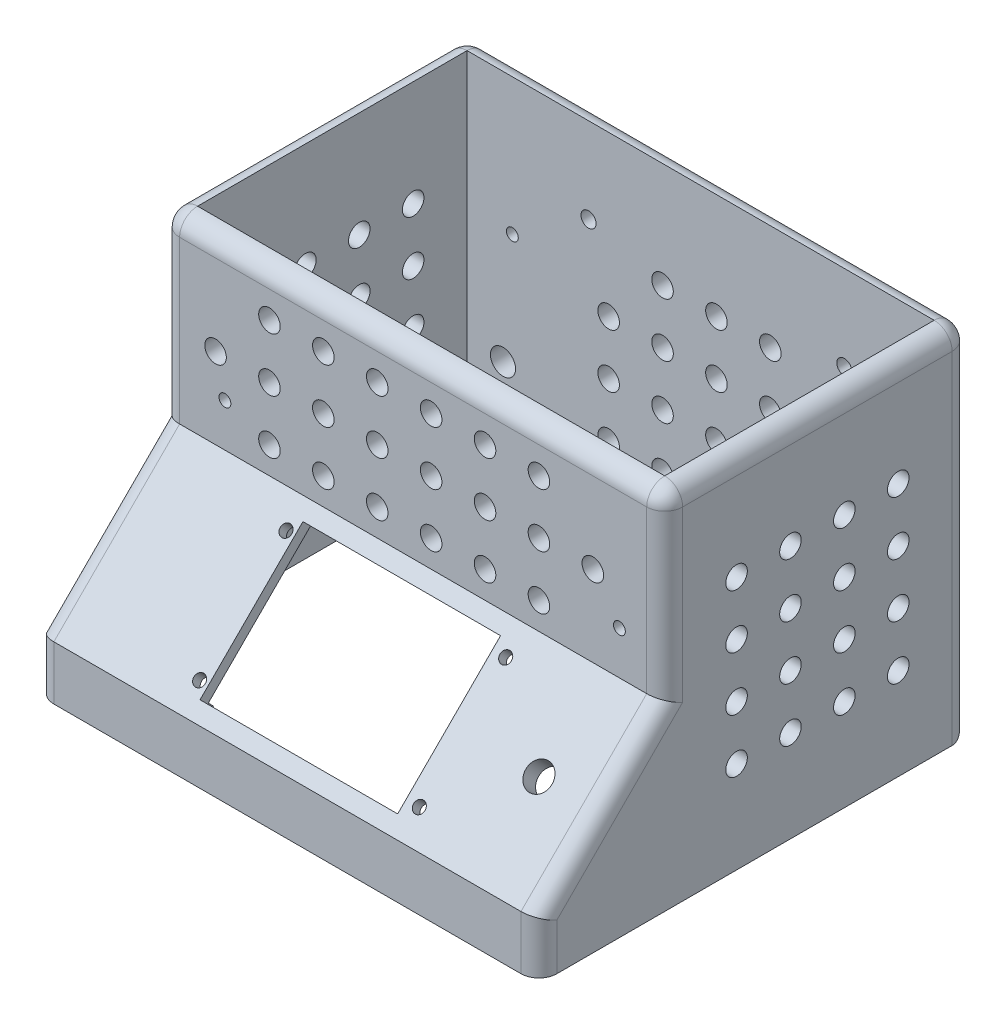
from build123d import *

# Parameters (mm, degrees)
SKETCH2_W                       = 85
SKETCH2_H                       = 100
BOSS_EXTRUDE1_DEPTH             = 70
SHELL1_T                        = -5
CUT_EXTRUDE1_REACH              = 146.59
SKETCH3_W                       = 130
SKETCH3_H                       = 110
SKETCH4_W                       = 55
SKETCH4_H                       = 40.5
CUT_EXTRUDE2_DEPTH              = 5
SKETCH5_W                       = 10.3
SKETCH5_H                       = 10.3
SKETCH5_R                       = 1.65
BOSS_EXTRUDE2_DEPTH             = 7
BOSS_EXTRUDE2_2_DEPTH           = 7
BOSS_EXTRUDE2_3_DEPTH           = 7
BOSS_EXTRUDE2_4_DEPTH           = 7
SKETCH6_R                       = 3.65
CUT_EXTRUDE3_DEPTH              = 10
SKETCH7_W                       = 10.3
SKETCH7_H                       = 10.3
SKETCH7_R                       = 1.65
BOSS_EXTRUDE3_DEPTH             = 5
CUT_EXTRUDE4_DEPTH              = 3
SKETCH14_R                      = 3.5
CUT_EXTRUDE19_DEPTH             = 5
SKETCH23_R                      = 2.1
CUT_EXTRUDE21_DEPTH             = 5
SKETCH22_R                      = 1.65
CUT_EXTRUDE27_DEPTH             = 2
SKETCH20_W                      = 6.75
SKETCH20_H                      = 40.25
SKETCH20_R                      = 1.6
SKETCH20_W_2                    = 5.5
CUT_EXTRUDE20_DEPTH             = 2
FILLET1_R                       = 5
CUT_EXTRUDE22_REACH             = 169.649
SKETCH28_R                      = 3
SKETCH29_R                      = 3
CUT_EXTRUDE23_DEPTH             = 5
SKETCH30_R                      = 1.6
CUT_EXTRUDE24_DEPTH             = 5
SKETCH31_R                      = 3
CUT_EXTRUDE26_DEPTH             = 5
CUT_EXTRUDE28_START             = -10
SKETCH32_W                      = 10.3
SKETCH32_H                      = 10.3
SKETCH32_W_2                    = 2.5
SKETCH32_H_2                    = 2.5
SKETCH32_W_3                    = 130
SKETCH32_H_3                    = 75
CUT_EXTRUDE28_DEPTH             = 10
CUT_EXTRUDE30_REACH             = 145.614
SKETCH34_R                      = 1.65
CUT_EXTRUDE30_DIRECTION_2_REACH = 145.614


with BuildPart() as part:
    # Sketch2 → Boss-Extrude1 (new, symmetric)
    with BuildSketch(Plane(origin=(0, 0, 0), x_dir=(0, 0, -1), z_dir=(1, 0, 0))):
        Rectangle(SKETCH2_W, SKETCH2_H)
        Polygon((-77.5, -35), (-77.5, -50), (-42.5, -50), (-42.5, 0), align=None)
    extrude(amount=BOSS_EXTRUDE1_DEPTH, both=True)

    # Shell1
    shell1_openings = [part.faces().sort_by_distance(p)[0] for p in [
        (0, 50, 0),
    ]]
    offset(amount=SHELL1_T, openings=shell1_openings, kind=Kind.INTERSECTION)

    # Sketch3 → Cut-Extrude1 (cut, up to next)
    with BuildSketch(Plane.XZ.offset(50), mode=Mode.PRIVATE) as cut_extrude1_sk1:
        with Locations((0, 17.5)):
            Rectangle(SKETCH3_W, SKETCH3_H)
    cut_extrude1_tool1 = extrude(cut_extrude1_sk1.sketch, amount=-CUT_EXTRUDE1_REACH, mode=Mode.PRIVATE) & part.part
    add(cut_extrude1_tool1.solids().sort_by_distance((0, -50, 17.5))[0], mode=Mode.SUBTRACT)

    # Sketch4 → Cut-Extrude2 (cut)
    with BuildSketch(Plane(origin=(0, 21.25, 21.25), x_dir=(1, 0, 0), z_dir=(0, 0.7071067811865464, 0.7071067811865488))):
        with Locations((0, -54.800775542)):
            Rectangle(SKETCH4_W, SKETCH4_H)
    extrude(amount=-CUT_EXTRUDE2_DEPTH, mode=Mode.SUBTRACT)

    # Sketch6 → Cut-Extrude3 (cut)
    with BuildSketch(Plane(origin=(0, 21.25, 21.25), x_dir=(1, 0, 0), z_dir=(0, 0.7071067811865464, 0.7071067811865488))):
        with Locations(Location((52.5, -54.800775542, 0), (0, 0, 270))):
            Circle(SKETCH6_R)
    extrude(amount=-CUT_EXTRUDE3_DEPTH, mode=Mode.SUBTRACT)

    # Sketch7 → Boss-Extrude3 (add)
    # profile 1 of 4: a face of its own
    with BuildSketch(Plane.XZ.offset(50)):
        with Locations((59.85, -32.35)):
            Rectangle(SKETCH7_W, SKETCH7_H)
        with Locations(Location((59.85, -32.35, 0), (0, 0, 270))):
            Circle(SKETCH7_R, mode=Mode.SUBTRACT)
    # profile 2 of 4: a face of its own
    with BuildSketch(Plane.XZ.offset(50)):
        with Locations((-59.85, -32.35)):
            Rectangle(SKETCH7_W, SKETCH7_H)
        with Locations(Location((-59.85, -32.35, 0), (0, 0, 270))):
            Circle(SKETCH7_R, mode=Mode.SUBTRACT)
    # profile 3 of 4: a face of its own
    with BuildSketch(Plane.XZ.offset(50)):
        with Locations((-59.85, 67.35)):
            Rectangle(SKETCH7_W, SKETCH7_H)
        with Locations(Location((-59.85, 67.35, 0), (0, 0, 270))):
            Circle(SKETCH7_R, mode=Mode.SUBTRACT)
    # profile 4 of 4: a face of its own
    with BuildSketch(Plane.XZ.offset(50)):
        with Locations((59.85, 67.35)):
            Rectangle(SKETCH7_W, SKETCH7_H)
        with Locations(Location((59.85, 67.35, 0), (0, 0, 270))):
            Circle(SKETCH7_R, mode=Mode.SUBTRACT)
    extrude(amount=-BOSS_EXTRUDE3_DEPTH)

    # Sketch8 → Cut-Extrude4 (cut)
    with BuildSketch(Plane(origin=(0, -45, 0), x_dir=(1, 0, 0), z_dir=(0, 1, 0))):
        Polygon((-61.5, 35.15), (-63.24642492, 32.35), (-61.5, 29.55), (-58.2, 29.55), (-56.45357508, 32.35), (-58.2, 35.15), align=None)
        Polygon((-61.5, -64.55), (-63.24642492, -67.35), (-61.5, -70.15), (-58.2, -70.15), (-56.45357508, -67.35), (-58.2, -64.55), align=None)
        Polygon((58.2, -64.55), (56.45357508, -67.35), (58.2, -70.15), (61.5, -70.15), (63.24642492, -67.35), (61.5, -64.55), align=None)
        Polygon((58.2, 29.55), (61.5, 29.55), (63.24642492, 32.35), (61.5, 35.15), (58.2, 35.15), (56.45357508, 32.35), align=None)
    extrude(amount=-CUT_EXTRUDE4_DEPTH, mode=Mode.SUBTRACT)

    # Sketch14 → Cut-Extrude19 (cut)
    with BuildSketch(Plane(origin=(0, 0, -42.5), x_dir=(-1, 0, 0), z_dir=(0, 0, -1))):
        with Locations(Location((55, -20, 0), (0, 0, 90))):
            Circle(SKETCH14_R)
    extrude(amount=-CUT_EXTRUDE19_DEPTH, mode=Mode.SUBTRACT)

    # Sketch23 → Cut-Extrude21 (cut)
    with BuildSketch(Plane(origin=(0, 0, -42.5), x_dir=(-1, 0, 0), z_dir=(0, 0, -1))):
        with Locations(Location((-40, -45, 0), (0, 0, 90))):
            Circle(SKETCH23_R)
        with Locations(Location((-40, 26.2, 0), (0, 0, 90))):
            Circle(SKETCH23_R)
        with Locations(Location((31.2, -45, 0), (0, 0, 90))):
            Circle(SKETCH23_R)
        with Locations(Location((31.2, 26.2, 0), (0, 0, 90))):
            Circle(SKETCH23_R)
    extrude(amount=-CUT_EXTRUDE21_DEPTH, mode=Mode.SUBTRACT)

    # Sketch20 → Cut-Extrude20 (cut)
    # profile 1 of 2: a face of its own
    with BuildSketch(Plane(origin=(0, 17.714466094, 17.714466094), x_dir=(1, 0, 0), z_dir=(0, -0.7071067811865464, -0.7071067811865488))):
        with Locations((30.875, 54.675775542)):
            Rectangle(SKETCH20_W, SKETCH20_H)
        with Locations(Location((31.2, 37.750775542, 0), (0, 0, 270))):
            Circle(SKETCH20_R, mode=Mode.SUBTRACT)
        with Locations(Location((31.2, 71.750775542, 0), (0, 0, 270))):
            Circle(SKETCH20_R, mode=Mode.SUBTRACT)
    # profile 2 of 2: a face of its own
    with BuildSketch(Plane(origin=(0, 17.714466094, 17.714466094), x_dir=(1, 0, 0), z_dir=(0, -0.7071067811865464, -0.7071067811865488))):
        with Locations((-30.25, 54.675775542)):
            Rectangle(SKETCH20_W_2, SKETCH20_H)
        with Locations(Location((-29.95, 37.750775542, 0), (0, 0, 270))):
            Circle(SKETCH20_R, mode=Mode.SUBTRACT)
        with Locations(Location((-29.95, 71.750775542, 0), (0, 0, 270))):
            Circle(SKETCH20_R, mode=Mode.SUBTRACT)
    extrude(amount=-CUT_EXTRUDE20_DEPTH, mode=Mode.SUBTRACT)

    # Fillet1
    # the kernel refuses this fillet: 5 mm, written as the material it takes off along each edge
    with BuildSketch(Plane(origin=(65, 45, 37.5), x_dir=(0, 0, 1), z_dir=(0, 1, 0))) as fillet1_piece_1_section:
        Polygon((0, 0), (FILLET1_R, 0), (FILLET1_R, FILLET1_R), (0, FILLET1_R), align=None)
    fillet1_piece_1 = extrude(amount=FILLET1_R, mode=Mode.PRIVATE)
    fillet1_piece_1 = fillet1_piece_1 - Plane(origin=(65, 45, 37.5), x_dir=(-0.7071067811865475, 0, -0.7071067811865475), z_dir=(0, 1, 0)) * Sphere(FILLET1_R, mode=Mode.PRIVATE)
    add(fillet1_piece_1, mode=Mode.SUBTRACT)
    with BuildSketch(Plane(origin=(65, 45, -37.5), x_dir=(0, 1, 0), z_dir=(0, 0, -1))) as fillet1_piece_2_section:
        Polygon((0, 0), (FILLET1_R, 0), (FILLET1_R, FILLET1_R), (0, FILLET1_R), align=None)
    fillet1_piece_2 = extrude(amount=FILLET1_R, mode=Mode.PRIVATE)
    fillet1_piece_2 = fillet1_piece_2 - Plane(origin=(65, 45, -37.5), x_dir=(-0.7071067811865475, -0.7071067811865475, 0), z_dir=(0, 0, -1)) * Sphere(FILLET1_R, mode=Mode.PRIVATE)
    add(fillet1_piece_2, mode=Mode.SUBTRACT)
    with BuildSketch(Plane(origin=(-65, 45, 37.5), x_dir=(0, 1, 0), z_dir=(-1, 0, 0))) as fillet1_piece_3_section:
        Polygon((0, 0), (FILLET1_R, 0), (FILLET1_R, -FILLET1_R), (0, -FILLET1_R), align=None)
    fillet1_piece_3 = extrude(amount=FILLET1_R, mode=Mode.PRIVATE)
    fillet1_piece_3 = fillet1_piece_3 - Plane(origin=(-65, 45, 37.5), x_dir=(0, -0.7071067811865475, -0.7071067811865476), z_dir=(-1, 0, 0)) * Sphere(FILLET1_R, mode=Mode.PRIVATE)
    add(fillet1_piece_3, mode=Mode.SUBTRACT)
    with BuildSketch(Plane(origin=(-65, 45, -37.5), x_dir=(0, 1, 0), z_dir=(-1, 0, 0))) as fillet1_piece_4_section:
        Polygon((0, 0), (FILLET1_R, 0), (FILLET1_R, FILLET1_R), (0, FILLET1_R), align=None)
    fillet1_piece_4 = extrude(amount=FILLET1_R, mode=Mode.PRIVATE)
    fillet1_piece_4 = fillet1_piece_4 - Plane(origin=(-65, 45, -37.5), x_dir=(0, -0.7071067811865477, 0.7071067811865475), z_dir=(-1, 0, 0)) * Sphere(FILLET1_R, mode=Mode.PRIVATE)
    add(fillet1_piece_4, mode=Mode.SUBTRACT)
    with BuildSketch(Plane(origin=(70, 50, 37.5), x_dir=(0, -1, 0), z_dir=(0, 0, -1))) as fillet1_piece_5:
        with BuildLine():
            CenterArc((FILLET1_R, FILLET1_R), FILLET1_R, 180, 90)
            Line((0, FILLET1_R), (0, 0))
            Line((0, 0), (FILLET1_R, 0))
        make_face()
    extrude(amount=75, mode=Mode.SUBTRACT)
    with BuildSketch(Plane(origin=(-70, 50, 37.5), x_dir=(0, -1, 0), z_dir=(0, 0, -1))) as fillet1_piece_6:
        with BuildLine():
            CenterArc((FILLET1_R, -FILLET1_R), FILLET1_R, 90, 90)
            Line((0, -FILLET1_R), (0, 0))
            Line((0, 0), (FILLET1_R, 0))
        make_face()
    extrude(amount=75, mode=Mode.SUBTRACT)
    with BuildSketch(Plane(origin=(-70, 45, -42.5), x_dir=(1, 0, 0), z_dir=(0, -1, 0))) as fillet1_piece_7:
        with BuildLine():
            CenterArc((FILLET1_R, FILLET1_R), FILLET1_R, 180, 90)
            Line((0, FILLET1_R), (0, 0))
            Line((0, 0), (FILLET1_R, 0))
        make_face()
    extrude(amount=107.5, mode=Mode.SUBTRACT)
    with BuildSketch(Plane(origin=(82.5, -50, -42.5), x_dir=(0, 1, 0), z_dir=(-1, 0, 0))) as fillet1_piece_8:
        with BuildLine():
            CenterArc((FILLET1_R, -FILLET1_R), FILLET1_R, 90, 90)
            Line((0, -FILLET1_R), (0, 0))
            Line((0, 0), (FILLET1_R, 0))
        make_face()
    extrude(amount=165, mode=Mode.SUBTRACT)
    with BuildSketch(Plane(origin=(-65, 50, 42.5), x_dir=(0, -1, 0), z_dir=(1, 0, 0))) as fillet1_piece_9:
        with BuildLine():
            CenterArc((FILLET1_R, FILLET1_R), FILLET1_R, 180, 90)
            Line((0, FILLET1_R), (0, 0))
            Line((0, 0), (FILLET1_R, 0))
        make_face()
    extrude(amount=130, mode=Mode.SUBTRACT)
    with BuildSketch(Plane(origin=(-65, 50, -42.5), x_dir=(0, -1, 0), z_dir=(1, 0, 0))) as fillet1_piece_10:
        with BuildLine():
            CenterArc((FILLET1_R, -FILLET1_R), FILLET1_R, 90, 90)
            Line((0, -FILLET1_R), (0, 0))
            Line((0, 0), (FILLET1_R, 0))
        make_face()
    extrude(amount=130, mode=Mode.SUBTRACT)
    with BuildSketch(Plane(origin=(70, -12.5, 42.5), x_dir=(-1, 0, 0), z_dir=(0, 1, 0))) as fillet1_piece_11_section:
        with BuildLine():
            CenterArc((FILLET1_R, -FILLET1_R), FILLET1_R, 90, 90)
            Line((0, -FILLET1_R), (0, 0))
            Line((0, 0), (FILLET1_R, 0))
        make_face()
    fillet1_piece_11 = extrude(amount=57.5, mode=Mode.PRIVATE)
    fillet1_piece_11 = split(fillet1_piece_11, bisect_by=Plane(origin=(68.852377092, 12.07911671, 30.42088329), z_dir=(0, 0.7071067811865462, 0.7071067811865488)), keep=Keep.TOP, mode=Mode.PRIVATE)
    add(fillet1_piece_11, mode=Mode.SUBTRACT)
    with BuildSketch(Plane(origin=(70, 8.838834765, 33.661165235), x_dir=(-1, 0, 0), z_dir=(0, -0.7071067811865488, 0.7071067811865462))) as fillet1_piece_12_section:
        with BuildLine():
            CenterArc((FILLET1_R, FILLET1_R), FILLET1_R, 180, 90)
            Line((0, FILLET1_R), (0, 0))
            Line((0, 0), (FILLET1_R, 0))
        make_face()
    fillet1_piece_12 = extrude(amount=74.497474683, mode=Mode.PRIVATE)
    fillet1_piece_12 = split(fillet1_piece_12, bisect_by=Plane(origin=(68.856746812, -23.099810896, 42.5), z_dir=(0, 0, 1)), keep=Keep.TOP, mode=Mode.PRIVATE)
    add(fillet1_piece_12, mode=Mode.SUBTRACT)
    with BuildSketch(Plane(origin=(70, -22.5, 77.5), x_dir=(-1, 0, 0), z_dir=(0, -1, 0))) as fillet1_piece_13:
        with BuildLine():
            CenterArc((FILLET1_R, FILLET1_R), FILLET1_R, 180, 90)
            Line((0, FILLET1_R), (0, 0))
            Line((0, 0), (FILLET1_R, 0))
        make_face()
    extrude(amount=40, mode=Mode.SUBTRACT)
    with BuildSketch(Plane(origin=(70, 45, -42.5), x_dir=(-1, 0, 0), z_dir=(0, -1, 0))) as fillet1_piece_14:
        with BuildLine():
            CenterArc((FILLET1_R, -FILLET1_R), FILLET1_R, 90, 90)
            Line((0, -FILLET1_R), (0, 0))
            Line((0, 0), (FILLET1_R, 0))
        make_face()
    extrude(amount=107.5, mode=Mode.SUBTRACT)
    with BuildSketch(Plane(origin=(-70, -22.5, 77.5), x_dir=(1, 0, 0), z_dir=(0, -1, 0))) as fillet1_piece_15:
        with BuildLine():
            CenterArc((FILLET1_R, -FILLET1_R), FILLET1_R, 90, 90)
            Line((0, -FILLET1_R), (0, 0))
            Line((0, 0), (FILLET1_R, 0))
        make_face()
    extrude(amount=40, mode=Mode.SUBTRACT)
    with BuildSketch(Plane(origin=(-70, 8.838834765, 33.661165235), x_dir=(1, 0, 0), z_dir=(0, -0.7071067811865488, 0.7071067811865462))) as fillet1_piece_16_section:
        with BuildLine():
            CenterArc((FILLET1_R, -FILLET1_R), FILLET1_R, 90, 90)
            Line((0, -FILLET1_R), (0, 0))
            Line((0, 0), (FILLET1_R, 0))
        make_face()
    fillet1_piece_16 = extrude(amount=74.497474683, mode=Mode.PRIVATE)
    fillet1_piece_16 = split(fillet1_piece_16, bisect_by=Plane(origin=(-68.856746812, -23.099810896, 42.5), z_dir=(0, 0, 1)), keep=Keep.TOP, mode=Mode.PRIVATE)
    add(fillet1_piece_16, mode=Mode.SUBTRACT)
    with BuildSketch(Plane(origin=(-70, -12.5, 42.5), x_dir=(1, 0, 0), z_dir=(0, 1, 0))) as fillet1_piece_17_section:
        with BuildLine():
            CenterArc((FILLET1_R, FILLET1_R), FILLET1_R, 180, 90)
            Line((0, FILLET1_R), (0, 0))
            Line((0, 0), (FILLET1_R, 0))
        make_face()
    fillet1_piece_17 = extrude(amount=57.5, mode=Mode.PRIVATE)
    fillet1_piece_17 = split(fillet1_piece_17, bisect_by=Plane(origin=(-68.852377092, 12.07911671, 30.42088329), z_dir=(0, 0.7071067811865462, 0.7071067811865488)), keep=Keep.TOP, mode=Mode.PRIVATE)
    add(fillet1_piece_17, mode=Mode.SUBTRACT)
    with BuildSketch(Plane(origin=(70, 8.838834765, 33.661165235), x_dir=(-1, 0, 0), z_dir=(0, -0.7071067811865488, 0.7071067811865462))) as fillet1_piece_18a_section:
        with BuildLine():
            CenterArc((FILLET1_R, FILLET1_R), FILLET1_R, 180, 90)
            Line((0, FILLET1_R), (0, 0))
            Line((0, 0), (FILLET1_R, 0))
        make_face()
    fillet1_piece_18a = extrude(amount=74.497474683, mode=Mode.PRIVATE)
    fillet1_piece_18a = split(fillet1_piece_18a, bisect_by=Plane(origin=(68.918377934, 3.128371039, 42.5), z_dir=(0, 0, -1)), keep=Keep.TOP, mode=Mode.PRIVATE)
    with BuildSketch(Plane(origin=(70, -12.5, 42.5), x_dir=(-1, 0, 0), z_dir=(0, 1, 0))) as fillet1_piece_18b_section:
        with BuildLine():
            CenterArc((FILLET1_R, -FILLET1_R), FILLET1_R, 90, 90)
            Line((0, -FILLET1_R), (0, 0))
            Line((0, 0), (FILLET1_R, 0))
        make_face()
    fillet1_piece_18b = extrude(amount=57.5, mode=Mode.PRIVATE)
    fillet1_piece_18b = split(fillet1_piece_18b, bisect_by=Plane(origin=(68.918377934, -2.212092376, 44.712092376), z_dir=(0, -0.7071067811865462, -0.7071067811865488)), keep=Keep.TOP, mode=Mode.PRIVATE)
    fillet1_piece_18 = fillet1_piece_18a & fillet1_piece_18b
    add(fillet1_piece_18, mode=Mode.SUBTRACT)
    with BuildSketch(Plane(origin=(-70, 8.838834765, 33.661165235), x_dir=(1, 0, 0), z_dir=(0, -0.7071067811865488, 0.7071067811865462))) as fillet1_piece_19a_section:
        with BuildLine():
            CenterArc((FILLET1_R, -FILLET1_R), FILLET1_R, 90, 90)
            Line((0, -FILLET1_R), (0, 0))
            Line((0, 0), (FILLET1_R, 0))
        make_face()
    fillet1_piece_19a = extrude(amount=74.497474683, mode=Mode.PRIVATE)
    fillet1_piece_19a = split(fillet1_piece_19a, bisect_by=Plane(origin=(-68.918377934, 3.128371039, 42.5), z_dir=(0, 0, -1)), keep=Keep.TOP, mode=Mode.PRIVATE)
    with BuildSketch(Plane(origin=(-70, -12.5, 42.5), x_dir=(1, 0, 0), z_dir=(0, 1, 0))) as fillet1_piece_19b_section:
        with BuildLine():
            CenterArc((FILLET1_R, FILLET1_R), FILLET1_R, 180, 90)
            Line((0, FILLET1_R), (0, 0))
            Line((0, 0), (FILLET1_R, 0))
        make_face()
    fillet1_piece_19b = extrude(amount=57.5, mode=Mode.PRIVATE)
    fillet1_piece_19b = split(fillet1_piece_19b, bisect_by=Plane(origin=(-68.918377934, -2.212092376, 44.712092376), z_dir=(0, -0.7071067811865462, -0.7071067811865488)), keep=Keep.TOP, mode=Mode.PRIVATE)
    fillet1_piece_19 = fillet1_piece_19a & fillet1_piece_19b
    add(fillet1_piece_19, mode=Mode.SUBTRACT)

    # Cut-Extrude22: up to this face of the body (flat: up to its plane)
    cut_extrude22_end = Plane(part.part.faces().sort_by_distance((70, -6.480218886, 6.715835531))[0])
    # Sketch28 → Cut-Extrude22 (cut, up to the picked face)
    with BuildSketch(Plane.ZY.offset(70), mode=Mode.PRIVATE) as cut_extrude22_sk1:
        with Locations((-22.5, 20.6)):
            Circle(SKETCH28_R)
    cut_extrude22_tool1 = split(extrude(cut_extrude22_sk1.sketch, amount=-CUT_EXTRUDE22_REACH, mode=Mode.PRIVATE), bisect_by=cut_extrude22_end, keep=Keep.BOTH, mode=Mode.PRIVATE)
    # Sketch28 → Cut-Extrude22 (cut, up to the picked face)
    with BuildSketch(Plane.ZY.offset(70), mode=Mode.PRIVATE) as cut_extrude22_sk2:
        with Locations((-7.5, 20.6)):
            Circle(SKETCH28_R)
    cut_extrude22_tool2 = split(extrude(cut_extrude22_sk2.sketch, amount=-CUT_EXTRUDE22_REACH, mode=Mode.PRIVATE), bisect_by=cut_extrude22_end, keep=Keep.BOTH, mode=Mode.PRIVATE)
    # Sketch28 → Cut-Extrude22 (cut, up to the picked face)
    with BuildSketch(Plane.ZY.offset(70), mode=Mode.PRIVATE) as cut_extrude22_sk3:
        with Locations((7.5, 20.6)):
            Circle(SKETCH28_R)
    cut_extrude22_tool3 = split(extrude(cut_extrude22_sk3.sketch, amount=-CUT_EXTRUDE22_REACH, mode=Mode.PRIVATE), bisect_by=cut_extrude22_end, keep=Keep.BOTH, mode=Mode.PRIVATE)
    # Sketch28 → Cut-Extrude22 (cut, up to the picked face)
    with BuildSketch(Plane.ZY.offset(70), mode=Mode.PRIVATE) as cut_extrude22_sk4:
        with Locations((22.5, 20.6)):
            Circle(SKETCH28_R)
    cut_extrude22_tool4 = split(extrude(cut_extrude22_sk4.sketch, amount=-CUT_EXTRUDE22_REACH, mode=Mode.PRIVATE), bisect_by=cut_extrude22_end, keep=Keep.BOTH, mode=Mode.PRIVATE)
    # Sketch28 → Cut-Extrude22 (cut, up to the picked face)
    with BuildSketch(Plane.ZY.offset(70), mode=Mode.PRIVATE) as cut_extrude22_sk5:
        with Locations((-7.5, 5.6)):
            Circle(SKETCH28_R)
    cut_extrude22_tool5 = split(extrude(cut_extrude22_sk5.sketch, amount=-CUT_EXTRUDE22_REACH, mode=Mode.PRIVATE), bisect_by=cut_extrude22_end, keep=Keep.BOTH, mode=Mode.PRIVATE)
    # Sketch28 → Cut-Extrude22 (cut, up to the picked face)
    with BuildSketch(Plane.ZY.offset(70), mode=Mode.PRIVATE) as cut_extrude22_sk6:
        with Locations((7.5, 5.6)):
            Circle(SKETCH28_R)
    cut_extrude22_tool6 = split(extrude(cut_extrude22_sk6.sketch, amount=-CUT_EXTRUDE22_REACH, mode=Mode.PRIVATE), bisect_by=cut_extrude22_end, keep=Keep.BOTH, mode=Mode.PRIVATE)
    # Sketch28 → Cut-Extrude22 (cut, up to the picked face)
    with BuildSketch(Plane.ZY.offset(70), mode=Mode.PRIVATE) as cut_extrude22_sk7:
        with Locations((22.5, 5.6)):
            Circle(SKETCH28_R)
    cut_extrude22_tool7 = split(extrude(cut_extrude22_sk7.sketch, amount=-CUT_EXTRUDE22_REACH, mode=Mode.PRIVATE), bisect_by=cut_extrude22_end, keep=Keep.BOTH, mode=Mode.PRIVATE)
    # Sketch28 → Cut-Extrude22 (cut, up to the picked face)
    with BuildSketch(Plane.ZY.offset(70), mode=Mode.PRIVATE) as cut_extrude22_sk8:
        with Locations((-7.5, -9.4)):
            Circle(SKETCH28_R)
    cut_extrude22_tool8 = split(extrude(cut_extrude22_sk8.sketch, amount=-CUT_EXTRUDE22_REACH, mode=Mode.PRIVATE), bisect_by=cut_extrude22_end, keep=Keep.BOTH, mode=Mode.PRIVATE)
    # Sketch28 → Cut-Extrude22 (cut, up to the picked face)
    with BuildSketch(Plane.ZY.offset(70), mode=Mode.PRIVATE) as cut_extrude22_sk9:
        with Locations((7.5, -9.4)):
            Circle(SKETCH28_R)
    cut_extrude22_tool9 = split(extrude(cut_extrude22_sk9.sketch, amount=-CUT_EXTRUDE22_REACH, mode=Mode.PRIVATE), bisect_by=cut_extrude22_end, keep=Keep.BOTH, mode=Mode.PRIVATE)
    # Sketch28 → Cut-Extrude22 (cut, up to the picked face)
    with BuildSketch(Plane.ZY.offset(70), mode=Mode.PRIVATE) as cut_extrude22_sk10:
        with Locations((22.5, -9.4)):
            Circle(SKETCH28_R)
    cut_extrude22_tool10 = split(extrude(cut_extrude22_sk10.sketch, amount=-CUT_EXTRUDE22_REACH, mode=Mode.PRIVATE), bisect_by=cut_extrude22_end, keep=Keep.BOTH, mode=Mode.PRIVATE)
    # Sketch28 → Cut-Extrude22 (cut, up to the picked face)
    with BuildSketch(Plane.ZY.offset(70), mode=Mode.PRIVATE) as cut_extrude22_sk11:
        with Locations((-7.5, -24.4)):
            Circle(SKETCH28_R)
    cut_extrude22_tool11 = split(extrude(cut_extrude22_sk11.sketch, amount=-CUT_EXTRUDE22_REACH, mode=Mode.PRIVATE), bisect_by=cut_extrude22_end, keep=Keep.BOTH, mode=Mode.PRIVATE)
    # Sketch28 → Cut-Extrude22 (cut, up to the picked face)
    with BuildSketch(Plane.ZY.offset(70), mode=Mode.PRIVATE) as cut_extrude22_sk12:
        with Locations((7.5, -24.4)):
            Circle(SKETCH28_R)
    cut_extrude22_tool12 = split(extrude(cut_extrude22_sk12.sketch, amount=-CUT_EXTRUDE22_REACH, mode=Mode.PRIVATE), bisect_by=cut_extrude22_end, keep=Keep.BOTH, mode=Mode.PRIVATE)
    # Sketch28 → Cut-Extrude22 (cut, up to the picked face)
    with BuildSketch(Plane.ZY.offset(70), mode=Mode.PRIVATE) as cut_extrude22_sk13:
        with Locations((22.5, -24.4)):
            Circle(SKETCH28_R)
    cut_extrude22_tool13 = split(extrude(cut_extrude22_sk13.sketch, amount=-CUT_EXTRUDE22_REACH, mode=Mode.PRIVATE), bisect_by=cut_extrude22_end, keep=Keep.BOTH, mode=Mode.PRIVATE)
    # Sketch28 → Cut-Extrude22 (cut, up to the picked face)
    with BuildSketch(Plane.ZY.offset(70), mode=Mode.PRIVATE) as cut_extrude22_sk14:
        with Locations((-22.5, 5.6)):
            Circle(SKETCH28_R)
    cut_extrude22_tool14 = split(extrude(cut_extrude22_sk14.sketch, amount=-CUT_EXTRUDE22_REACH, mode=Mode.PRIVATE), bisect_by=cut_extrude22_end, keep=Keep.BOTH, mode=Mode.PRIVATE)
    # Sketch28 → Cut-Extrude22 (cut, up to the picked face)
    with BuildSketch(Plane.ZY.offset(70), mode=Mode.PRIVATE) as cut_extrude22_sk15:
        with Locations((-22.5, -9.4)):
            Circle(SKETCH28_R)
    cut_extrude22_tool15 = split(extrude(cut_extrude22_sk15.sketch, amount=-CUT_EXTRUDE22_REACH, mode=Mode.PRIVATE), bisect_by=cut_extrude22_end, keep=Keep.BOTH, mode=Mode.PRIVATE)
    # Sketch28 → Cut-Extrude22 (cut, up to the picked face)
    with BuildSketch(Plane.ZY.offset(70), mode=Mode.PRIVATE) as cut_extrude22_sk16:
        with Locations((-22.5, -24.4)):
            Circle(SKETCH28_R)
    cut_extrude22_tool16 = split(extrude(cut_extrude22_sk16.sketch, amount=-CUT_EXTRUDE22_REACH, mode=Mode.PRIVATE), bisect_by=cut_extrude22_end, keep=Keep.BOTH, mode=Mode.PRIVATE)
    add(cut_extrude22_tool1.solids().sort_by(Axis((-70, 20.6, -22.5), (1, 0, 0)))[0], mode=Mode.SUBTRACT)
    add(cut_extrude22_tool2.solids().sort_by(Axis((-70, 20.6, -7.5), (1, 0, 0)))[0], mode=Mode.SUBTRACT)
    add(cut_extrude22_tool3.solids().sort_by(Axis((-70, 20.6, 7.5), (1, 0, 0)))[0], mode=Mode.SUBTRACT)
    add(cut_extrude22_tool4.solids().sort_by(Axis((-70, 20.6, 22.5), (1, 0, 0)))[0], mode=Mode.SUBTRACT)
    add(cut_extrude22_tool5.solids().sort_by(Axis((-70, 5.6, -7.5), (1, 0, 0)))[0], mode=Mode.SUBTRACT)
    add(cut_extrude22_tool6.solids().sort_by(Axis((-70, 5.6, 7.5), (1, 0, 0)))[0], mode=Mode.SUBTRACT)
    add(cut_extrude22_tool7.solids().sort_by(Axis((-70, 5.6, 22.5), (1, 0, 0)))[0], mode=Mode.SUBTRACT)
    add(cut_extrude22_tool8.solids().sort_by(Axis((-70, -9.4, -7.5), (1, 0, 0)))[0], mode=Mode.SUBTRACT)
    add(cut_extrude22_tool9.solids().sort_by(Axis((-70, -9.4, 7.5), (1, 0, 0)))[0], mode=Mode.SUBTRACT)
    add(cut_extrude22_tool10.solids().sort_by(Axis((-70, -9.4, 22.5), (1, 0, 0)))[0], mode=Mode.SUBTRACT)
    add(cut_extrude22_tool11.solids().sort_by(Axis((-70, -24.4, -7.5), (1, 0, 0)))[0], mode=Mode.SUBTRACT)
    add(cut_extrude22_tool12.solids().sort_by(Axis((-70, -24.4, 7.5), (1, 0, 0)))[0], mode=Mode.SUBTRACT)
    add(cut_extrude22_tool13.solids().sort_by(Axis((-70, -24.4, 22.5), (1, 0, 0)))[0], mode=Mode.SUBTRACT)
    add(cut_extrude22_tool14.solids().sort_by(Axis((-70, 5.6, -22.5), (1, 0, 0)))[0], mode=Mode.SUBTRACT)
    add(cut_extrude22_tool15.solids().sort_by(Axis((-70, -9.4, -22.5), (1, 0, 0)))[0], mode=Mode.SUBTRACT)
    add(cut_extrude22_tool16.solids().sort_by(Axis((-70, -24.4, -22.5), (1, 0, 0)))[0], mode=Mode.SUBTRACT)

    # Sketch29 → Cut-Extrude23 (cut)
    with BuildSketch(Plane.XY.offset(42.5)):
        with Locations((-40, 37.5)):
            Circle(SKETCH29_R)
        with Locations((-25, 37.5)):
            Circle(SKETCH29_R)
        with Locations((-10, 37.5)):
            Circle(SKETCH29_R)
        with Locations((5, 37.5)):
            Circle(SKETCH29_R)
        with Locations((20, 37.5)):
            Circle(SKETCH29_R)
        with Locations((35, 37.5)):
            Circle(SKETCH29_R)
        with Locations((-40, 22.5)):
            Circle(SKETCH29_R)
        with Locations((-25, 22.5)):
            Circle(SKETCH29_R)
        with Locations((-10, 22.5)):
            Circle(SKETCH29_R)
        with Locations((5, 22.5)):
            Circle(SKETCH29_R)
        with Locations((20, 22.5)):
            Circle(SKETCH29_R)
        with Locations((35, 22.5)):
            Circle(SKETCH29_R)
        with Locations((50, 22.5)):
            Circle(SKETCH29_R)
        with Locations((-40, 7.5)):
            Circle(SKETCH29_R)
        with Locations((-25, 7.5)):
            Circle(SKETCH29_R)
        with Locations((-10, 7.5)):
            Circle(SKETCH29_R)
        with Locations((5, 7.5)):
            Circle(SKETCH29_R)
        with Locations((20, 7.5)):
            Circle(SKETCH29_R)
        with Locations((35, 7.5)):
            Circle(SKETCH29_R)
        with Locations((-55, 22.5)):
            Circle(SKETCH29_R)
    extrude(amount=-CUT_EXTRUDE23_DEPTH, mode=Mode.SUBTRACT)

    # Sketch30 → Cut-Extrude24 (cut)
    with BuildSketch(Plane(origin=(0, 17.714466094, 17.714466094), x_dir=(1, 0, 0), z_dir=(0, -0.7071067811865464, -0.7071067811865488))):
        with Locations(Location((-29.95, 71.750775542, 0), (0, 0, 270))):
            Circle(SKETCH30_R)
        with Locations(Location((-29.95, 37.750775542, 0), (0, 0, 270))):
            Circle(SKETCH30_R)
        with Locations(Location((31.2, 37.750775542, 0), (0, 0, 270))):
            Circle(SKETCH30_R)
        with Locations(Location((31.2, 71.750775542, 0), (0, 0, 270))):
            Circle(SKETCH30_R)
    extrude(amount=-CUT_EXTRUDE24_DEPTH, mode=Mode.SUBTRACT)

    # Sketch31 → Cut-Extrude26 (cut)
    with BuildSketch(Plane(origin=(0, 0, -42.5), x_dir=(-1, 0, 0), z_dir=(0, 0, -1))):
        with Locations(Location((-19.4, 20.6, 0), (0, 0, 90))):
            Circle(SKETCH31_R)
        with Locations(Location((-4.4, 20.6, 0), (0, 0, 90))):
            Circle(SKETCH31_R)
        with Locations(Location((10.6, 20.6, 0), (0, 0, 90))):
            Circle(SKETCH31_R)
        with Locations(Location((-19.4, 5.6, 0), (0, 0, 90))):
            Circle(SKETCH31_R)
        with Locations(Location((-4.4, 5.6, 0), (0, 0, 90))):
            Circle(SKETCH31_R)
        with Locations(Location((10.6, 5.6, 0), (0, 0, 90))):
            Circle(SKETCH31_R)
        with Locations(Location((-19.4, -9.4, 0), (0, 0, 90))):
            Circle(SKETCH31_R)
        with Locations(Location((-4.4, -9.4, 0), (0, 0, 90))):
            Circle(SKETCH31_R)
        with Locations(Location((10.6, -9.4, 0), (0, 0, 90))):
            Circle(SKETCH31_R)
        with Locations(Location((-19.4, -24.4, 0), (0, 0, 90))):
            Circle(SKETCH31_R)
        with Locations(Location((-4.4, -24.4, 0), (0, 0, 90))):
            Circle(SKETCH31_R)
        with Locations(Location((10.6, -24.4, 0), (0, 0, 90))):
            Circle(SKETCH31_R)
        with Locations(Location((-34.4, 5.6, 0), (0, 0, 90))):
            Circle(SKETCH31_R)
        with Locations(Location((-34.4, -9.4, 0), (0, 0, 90))):
            Circle(SKETCH31_R)
        with Locations(Location((-34.4, -24.4, 0), (0, 0, 90))):
            Circle(SKETCH31_R)
        with Locations(Location((-19.4, -39.4, 0), (0, 0, 90))):
            Circle(SKETCH31_R)
        with Locations(Location((-4.4, -39.4, 0), (0, 0, 90))):
            Circle(SKETCH31_R)
        with Locations(Location((10.6, -39.4, 0), (0, 0, 90))):
            Circle(SKETCH31_R)
        with Locations(Location((25.6, 5.6, 0), (0, 0, 90))):
            Circle(SKETCH31_R)
        with Locations(Location((25.6, -9.4, 0), (0, 0, 90))):
            Circle(SKETCH31_R)
        with Locations(Location((25.6, -24.4, 0), (0, 0, 90))):
            Circle(SKETCH31_R)
    extrude(amount=-CUT_EXTRUDE26_DEPTH, mode=Mode.SUBTRACT)

    # Cut-Extrude30: up to this face of the body (flat: up to its plane)
    cut_extrude30_end = Plane(part.part.faces().sort_by_distance((-0.061560586, 0.565578164, -42.5))[0])
    # Sketch34 → Cut-Extrude30 (cut, up to the picked face)
    with BuildSketch(Plane.XY.offset(-37.5), mode=Mode.PRIVATE) as cut_extrude30_sk1:
        with Locations(Location((-52.4, 12, 0), (0, 0, 90))):
            Circle(SKETCH34_R)
    cut_extrude30_tool1 = split(extrude(cut_extrude30_sk1.sketch, amount=-CUT_EXTRUDE30_REACH, mode=Mode.PRIVATE), bisect_by=cut_extrude30_end, keep=Keep.BOTH, mode=Mode.PRIVATE)
    # Sketch34 → Cut-Extrude30 (cut, up to the picked face)
    with BuildSketch(Plane.XY.offset(-37.5), mode=Mode.PRIVATE) as cut_extrude30_sk2:
        with Locations(Location((57.4, 12, 0), (0, 0, 90))):
            Circle(SKETCH34_R)
    cut_extrude30_tool2 = split(extrude(cut_extrude30_sk2.sketch, amount=-CUT_EXTRUDE30_REACH, mode=Mode.PRIVATE), bisect_by=cut_extrude30_end, keep=Keep.BOTH, mode=Mode.PRIVATE)
    add(cut_extrude30_tool1.solids().sort_by(Axis((-52.4, 12, -37.5), (0, 0, -1)))[0], mode=Mode.SUBTRACT)
    add(cut_extrude30_tool2.solids().sort_by(Axis((57.4, 12, -37.5), (0, 0, -1)))[0], mode=Mode.SUBTRACT)

    # Cut-Extrude30 direction 2: up to this face of the body (flat: up to its plane)
    cut_extrude30_direction_2_end = Plane(part.part.faces().sort_by_distance((0.267520698, 22.5, 42.5))[0])
    # Sketch34 → Cut-Extrude30 direction 2 (cut, up to the picked face)
    with BuildSketch(Plane.XY.offset(-37.5), mode=Mode.PRIVATE) as cut_extrude30_direction_2_sk1:
        with Locations(Location((-52.4, 12, 0), (0, 0, 90))):
            Circle(SKETCH34_R)
    cut_extrude30_direction_2_tool1 = split(extrude(cut_extrude30_direction_2_sk1.sketch, amount=CUT_EXTRUDE30_DIRECTION_2_REACH, mode=Mode.PRIVATE), bisect_by=cut_extrude30_direction_2_end, keep=Keep.BOTH, mode=Mode.PRIVATE)
    # Sketch34 → Cut-Extrude30 direction 2 (cut, up to the picked face)
    with BuildSketch(Plane.XY.offset(-37.5), mode=Mode.PRIVATE) as cut_extrude30_direction_2_sk2:
        with Locations(Location((57.4, 12, 0), (0, 0, 90))):
            Circle(SKETCH34_R)
    cut_extrude30_direction_2_tool2 = split(extrude(cut_extrude30_direction_2_sk2.sketch, amount=CUT_EXTRUDE30_DIRECTION_2_REACH, mode=Mode.PRIVATE), bisect_by=cut_extrude30_direction_2_end, keep=Keep.BOTH, mode=Mode.PRIVATE)
    add(cut_extrude30_direction_2_tool1.solids().sort_by(Axis((-52.4, 12, -37.5), (0, 0, 1)))[0], mode=Mode.SUBTRACT)
    add(cut_extrude30_direction_2_tool2.solids().sort_by(Axis((57.4, 12, -37.5), (0, 0, 1)))[0], mode=Mode.SUBTRACT)


with BuildPart() as body_2:
    # Sketch5 → Boss-Extrude2 (new body)
    with BuildSketch(Plane(origin=(0, 50, 0), x_dir=(1, 0, 0), z_dir=(0, 1, 0))):
        with Locations((-50.05, 32.35)):
            Rectangle(SKETCH5_W, SKETCH5_H)
        with Locations(Location((-50.05, 32.35, 0), (0, 0, 270))):
            Circle(SKETCH5_R, mode=Mode.SUBTRACT)
    extrude(amount=-BOSS_EXTRUDE2_DEPTH)


with BuildPart() as body_3:
    # Sketch5 → Boss-Extrude2 2 (new body)
    with BuildSketch(Plane(origin=(0, 50, 0), x_dir=(1, 0, 0), z_dir=(0, 1, 0))):
        with Locations((-50.05, -32.35)):
            Rectangle(SKETCH5_W, SKETCH5_H)
        with Locations(Location((-50.05, -32.35, 0), (0, 0, 270))):
            Circle(SKETCH5_R, mode=Mode.SUBTRACT)
    extrude(amount=-BOSS_EXTRUDE2_2_DEPTH)


with BuildPart() as body_4:
    # Sketch5 → Boss-Extrude2 3 (new body)
    with BuildSketch(Plane(origin=(0, 50, 0), x_dir=(1, 0, 0), z_dir=(0, 1, 0))):
        with Locations((59.85, 32.35)):
            Rectangle(SKETCH5_W, SKETCH5_H)
        with Locations(Location((59.85, 32.35, 0), (0, 0, 270))):
            Circle(SKETCH5_R, mode=Mode.SUBTRACT)
    extrude(amount=-BOSS_EXTRUDE2_3_DEPTH)


with BuildPart() as body_5:
    # Sketch5 → Boss-Extrude2 4 (new body)
    with BuildSketch(Plane(origin=(0, 50, 0), x_dir=(1, 0, 0), z_dir=(0, 1, 0))):
        with Locations((59.85, -32.35)):
            Rectangle(SKETCH5_W, SKETCH5_H)
        with Locations(Location((59.85, -32.35, 0), (0, 0, 270))):
            Circle(SKETCH5_R, mode=Mode.SUBTRACT)
    extrude(amount=-BOSS_EXTRUDE2_4_DEPTH)


with BuildPart() as cut_extrude27_tool:
    # Sketch22 → Cut-Extrude27 (new body)
    # profile 1 of 8: a face of its own
    with BuildSketch(Plane.XZ.offset(-43)):
        Polygon((-51.7, 35.15), (-53.44642492, 32.35), (-51.7, 29.55), (-48.4, 29.55), (-46.65357508, 32.35), (-48.4, 35.15), align=None)
        with Locations(Location((-50.05, 32.35, 0), (0, 0, 90))):
            Circle(SKETCH22_R, mode=Mode.SUBTRACT)
    # profile 2 of 8: a face of its own
    with BuildSketch(Plane.XZ.offset(-43)):
        with Locations(Location((-50.05, 32.35, 0), (0, 0, 90))):
            Circle(SKETCH22_R)
    # profile 3 of 8: a face of its own
    with BuildSketch(Plane.XZ.offset(-43)):
        Polygon((58.2, 35.15), (56.45357508, 32.35), (58.2, 29.55), (61.5, 29.55), (63.24642492, 32.35), (61.5, 35.15), align=None)
        with Locations(Location((59.85, 32.35, 0), (0, 0, 90))):
            Circle(SKETCH22_R, mode=Mode.SUBTRACT)
    # profile 4 of 8: a face of its own
    with BuildSketch(Plane.XZ.offset(-43)):
        with Locations(Location((59.85, 32.35, 0), (0, 0, 90))):
            Circle(SKETCH22_R)
    # profile 5 of 8: a face of its own
    with BuildSketch(Plane.XZ.offset(-43)):
        Polygon((58.2, -29.55), (61.5, -29.55), (63.24642492, -32.35), (61.5, -35.15), (58.2, -35.15), (56.45357508, -32.35), align=None)
        with Locations(Location((59.85, -32.35, 0), (0, 0, 270))):
            Circle(SKETCH22_R, mode=Mode.SUBTRACT)
    # profile 6 of 8: a face of its own
    with BuildSketch(Plane.XZ.offset(-43)):
        with Locations(Location((59.85, -32.35, 0), (0, 0, 270))):
            Circle(SKETCH22_R)
    # profile 7 of 8: a face of its own
    with BuildSketch(Plane.XZ.offset(-43)):
        Polygon((-51.7, -29.55), (-53.44642492, -32.35), (-51.7, -35.15), (-48.4, -35.15), (-46.65357508, -32.35), (-48.4, -29.55), align=None)
        with Locations(Location((-50.05, -32.35, 0), (0, 0, 90))):
            Circle(SKETCH22_R, mode=Mode.SUBTRACT)
    # profile 8 of 8: a face of its own
    with BuildSketch(Plane.XZ.offset(-43)):
        with Locations(Location((-50.05, -32.35, 0), (0, 0, 90))):
            Circle(SKETCH22_R)
    extrude(amount=-CUT_EXTRUDE27_DEPTH)


with BuildPart() as body_2_1:
    add(body_2.part)

    # Cut-Extrude27: cut by cut_extrude27_tool
    add(cut_extrude27_tool.part, mode=Mode.SUBTRACT)


with BuildPart() as body_3_1:
    add(body_3.part)

    # Cut-Extrude27: cut by cut_extrude27_tool
    add(cut_extrude27_tool.part, mode=Mode.SUBTRACT)


with BuildPart() as body_4_1:
    add(body_4.part)

    # Cut-Extrude27: cut by cut_extrude27_tool
    add(cut_extrude27_tool.part, mode=Mode.SUBTRACT)


with BuildPart() as body_5_1:
    add(body_5.part)

    # Cut-Extrude27: cut by cut_extrude27_tool
    add(cut_extrude27_tool.part, mode=Mode.SUBTRACT)


with BuildPart() as cut_extrude28_tool:
    # Sketch32 → Cut-Extrude28 (new body)
    with BuildSketch(Plane(origin=(0, 50, 0), x_dir=(1, 0, 0), z_dir=(0, 1, 0)).offset(CUT_EXTRUDE28_START)):
        with Locations((59.85, -32.35)):
            Rectangle(SKETCH32_W, SKETCH32_H)
        Polygon((54.7, -27.2), (65, -27.2), (65, 27.2), (54.7, 27.2), (54.7, 37.5), (-44.9, 37.5), (-44.9, 27.2), (-55.2, 27.2), (-55.2, 37.5), (-65, 37.5), (-65, -37.5), (-55.2, -37.5), (-55.2, -27.2), (-44.9, -27.2), (-44.9, -37.5), (54.7, -37.5), align=None)
        Polygon((65, 27.2), (65, -27.2), (65, -37.5), (67.5, -37.5), (67.5, 37.5), (65, 37.5), align=None)
        with Locations((59.85, 32.35)):
            Rectangle(SKETCH32_W, SKETCH32_H)
        with Locations((66.25, -38.75)):
            Rectangle(SKETCH32_W_2, SKETCH32_H_2)
        Polygon((65, -40), (65, -37.5), (54.7, -37.5), (-44.9, -37.5), (-55.2, -37.5), (-65, -37.5), (-65, -40), align=None)
        Polygon((54.7, 37.5), (65, 37.5), (65, 40), (-65, 40), (-65, 37.5), (-55.2, 37.5), (-44.9, 37.5), align=None)
        with Locations((66.25, 38.75)):
            Rectangle(SKETCH32_W_2, SKETCH32_H_2)
        with BuildLine():
            Line((67.5, -40), (65, -40))
            Line((65, -40), (65, -42.5))
            ThreePointArc((65, -42.5), (68.535533906, -41.035533906), (70, -37.5))
            Line((70, -37.5), (67.5, -37.5))
            Line((67.5, -37.5), (67.5, -40))
        make_face()
        with Locations((0, -41.25)):
            Rectangle(SKETCH32_W_3, SKETCH32_H_2)
        with Locations((68.75, 0)):
            Rectangle(SKETCH32_W_2, SKETCH32_H_3)
        with Locations((-50.05, -32.35)):
            Rectangle(SKETCH32_W, SKETCH32_H)
        with Locations((0, 41.25)):
            Rectangle(SKETCH32_W_3, SKETCH32_H_2)
        with BuildLine():
            Line((65, 42.5), (65, 40))
            Line((65, 40), (67.5, 40))
            Line((67.5, 40), (67.5, 37.5))
            Line((67.5, 37.5), (70, 37.5))
            ThreePointArc((70, 37.5), (68.535533906, 41.035533906), (65, 42.5))
        make_face()
        with Locations((-66.25, -38.75)):
            Rectangle(SKETCH32_W_2, SKETCH32_H_2)
        with BuildLine():
            Line((-65, -42.5), (-65, -40))
            Line((-65, -40), (-67.5, -40))
            Line((-67.5, -40), (-67.5, -37.5))
            Line((-67.5, -37.5), (-70, -37.5))
            ThreePointArc((-70, -37.5), (-68.535533906, -41.035533906), (-65, -42.5))
        make_face()
        with Locations((-50.05, 32.35)):
            Rectangle(SKETCH32_W, SKETCH32_H)
        with BuildLine():
            Line((-67.5, 40), (-65, 40))
            Line((-65, 40), (-65, 42.5))
            ThreePointArc((-65, 42.5), (-68.535533906, 41.035533906), (-70, 37.5))
            Line((-70, 37.5), (-67.5, 37.5))
            Line((-67.5, 37.5), (-67.5, 40))
        make_face()
        with Locations((-66.25, 38.75)):
            Rectangle(SKETCH32_W_2, SKETCH32_H_2)
        with Locations((-66.25, 0)):
            Rectangle(SKETCH32_W_2, SKETCH32_H_3)
        with Locations((-68.75, 0)):
            Rectangle(SKETCH32_W_2, SKETCH32_H_3)
    extrude(amount=CUT_EXTRUDE28_DEPTH)


with BuildPart() as body_5_2:
    add(body_5_1.part)

    # Cut-Extrude28: cut by cut_extrude28_tool
    add(cut_extrude28_tool.part, mode=Mode.SUBTRACT)


with BuildPart() as body_2_2:
    add(body_2_1.part)

    # Cut-Extrude28: cut by cut_extrude28_tool
    add(cut_extrude28_tool.part, mode=Mode.SUBTRACT)


with BuildPart() as body_3_2:
    add(body_3_1.part)

    # Cut-Extrude28: cut by cut_extrude28_tool
    add(cut_extrude28_tool.part, mode=Mode.SUBTRACT)


with BuildPart() as body_4_2:
    add(body_4_1.part)

    # Cut-Extrude28: cut by cut_extrude28_tool
    add(cut_extrude28_tool.part, mode=Mode.SUBTRACT)


solid = part.part
